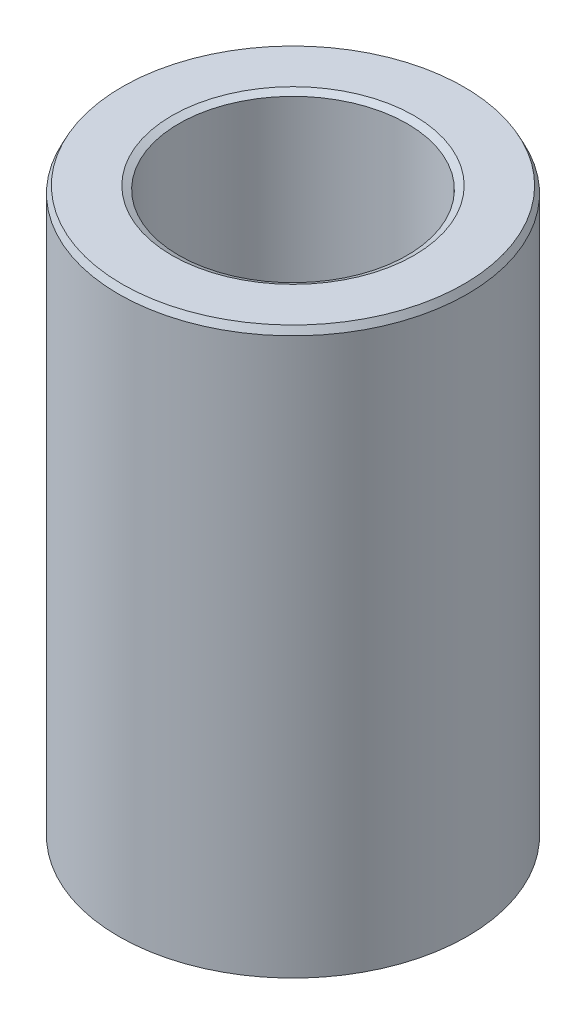
from build123d import *
from OCP.BRepFilletAPI import BRepFilletAPI_MakeChamfer

# Parameters (mm, degrees)
SKETCH1_R           = 27.5
BOSS_EXTRUDE1_DEPTH = 89.377396188
SKETCH2_R           = 18.004063808
CUT_EXTRUDE1_DEPTH  = 98.472144479
CHAMFER1_SIZE       = 1.091930543
CHAMFER1_SIZE2      = 0.546437469


with BuildPart() as part:
    # Sketch1 → Boss-Extrude1 (new body)
    with BuildSketch(Plane(origin=(0, 0, 0), x_dir=(1, 0, 0), z_dir=(0, 1, 0))):
        Circle(SKETCH1_R)
    extrude(amount=BOSS_EXTRUDE1_DEPTH)

    # Sketch2 → Cut-Extrude1 (cut, through all)
    with BuildSketch(Plane(origin=(0, 0, 0), x_dir=(1, 0, 0), z_dir=(0, 1, 0))):
        Circle(SKETCH2_R)
    extrude(amount=CUT_EXTRUDE1_DEPTH, mode=Mode.SUBTRACT)

    # Chamfer1: one chamfer whose edges measure the first distance from different faces: ONE call of the kernel's chamfer builder (chamfer() names one face for all edges)
    chamfer1_edges_1 = [part.edges().sort_by_distance(p)[0] for p in [
        (-18.004063808, 89.377396188, 0),
    ]]
    chamfer1_side_1 = [part.faces().sort_by_distance(p)[0] for p in [
        (-26.722182541, 89.377396188, 0),
    ]]
    chamfer1_edges_2 = [part.edges().sort_by_distance(p)[0] for p in [
        (-18.004063808, 0, 0),
    ]]
    chamfer1_side_2 = [part.faces().sort_by_distance(p)[0] for p in [
        (-18.004063808, 44.688698094, 0),
    ]]
    chamfer1_edges_3 = [part.edges().sort_by_distance(p)[0] for p in [
        (-27.5, 0, 0),
    ]]
    chamfer1_side_3 = [part.faces().sort_by_distance(p)[0] for p in [
        (-26.722182541, 0, 0),
    ]]
    chamfer1_edges_4 = [part.edges().sort_by_distance(p)[0] for p in [
        (-27.5, 89.377396188, 0),
    ]]
    chamfer1_side_4 = [part.faces().sort_by_distance(p)[0] for p in [
        (-27.5, 44.688698094, 0),
    ]]
    chamfer1 = BRepFilletAPI_MakeChamfer(part.part.solid().wrapped)
    for e in chamfer1_edges_1:
        chamfer1.Add(CHAMFER1_SIZE, CHAMFER1_SIZE2, e.wrapped, chamfer1_side_1[0].wrapped)  # the first distance lies on this face
    for e in chamfer1_edges_2:
        chamfer1.Add(CHAMFER1_SIZE, CHAMFER1_SIZE2, e.wrapped, chamfer1_side_2[0].wrapped)  # the first distance lies on this face
    for e in chamfer1_edges_3:
        chamfer1.Add(CHAMFER1_SIZE, CHAMFER1_SIZE2, e.wrapped, chamfer1_side_3[0].wrapped)  # the first distance lies on this face
    for e in chamfer1_edges_4:
        chamfer1.Add(CHAMFER1_SIZE, CHAMFER1_SIZE2, e.wrapped, chamfer1_side_4[0].wrapped)  # the first distance lies on this face
    add(Compound.cast(chamfer1.Shape()), mode=Mode.REPLACE)


solid = part.part
